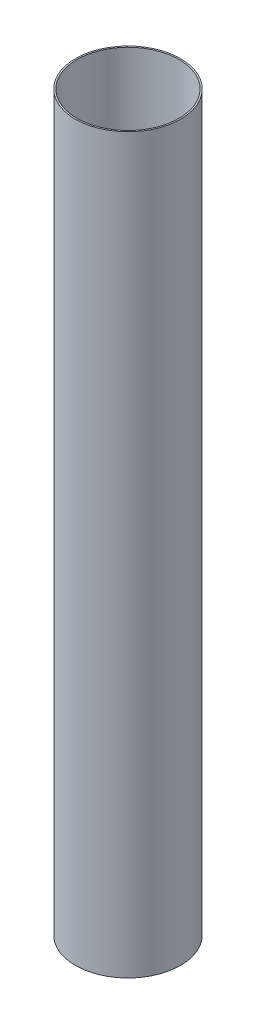
from build123d import *

# Parameters (mm, degrees)
MOTOR_MOUNT_PROFILE_SKETCH_R   = 50.9778
MOTOR_MOUNT_PROFILE_SKETCH_R_2 = 49.53
MOTOR_MOUNT_BODY_DEPTH         = 711.2


with BuildPart() as part:
    # Motor Mount Profile Sketch → Motor Mount Body (new body)
    with BuildSketch(Plane(origin=(0, 0, 0), x_dir=(1, 0, 0), z_dir=(0, 1, 0))):
        Circle(MOTOR_MOUNT_PROFILE_SKETCH_R)
        Circle(MOTOR_MOUNT_PROFILE_SKETCH_R_2, mode=Mode.SUBTRACT)
    extrude(amount=MOTOR_MOUNT_BODY_DEPTH)


solid = part.part
